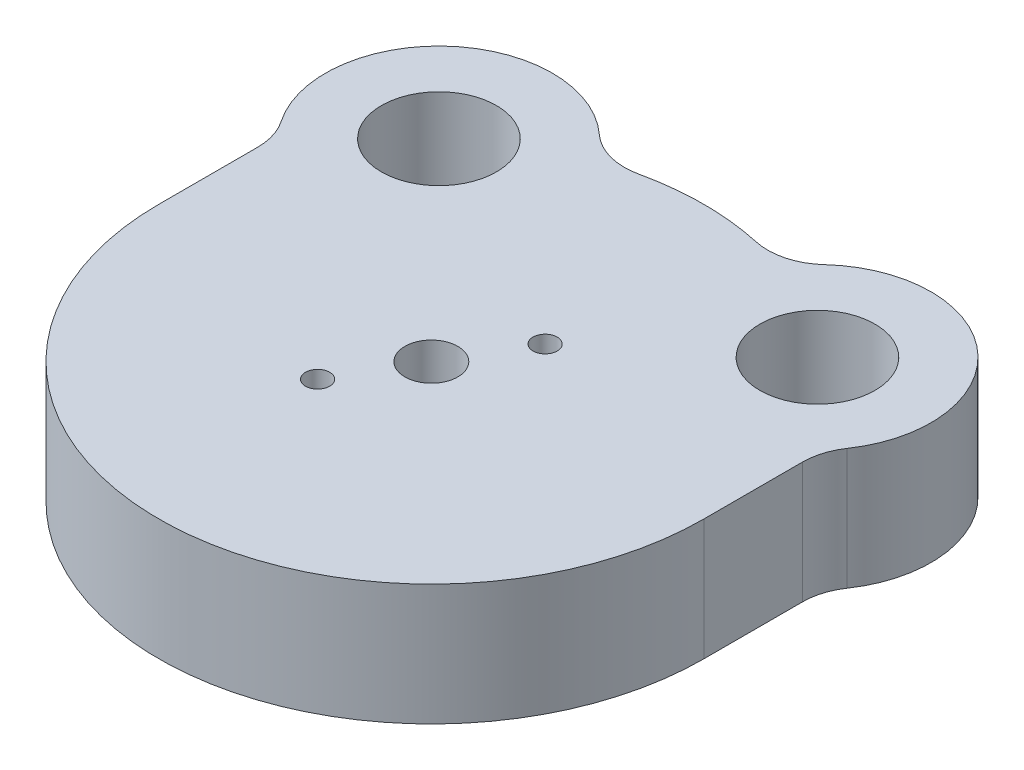
from build123d import *

# Parameters (mm, degrees)
BOSS_EXTRUDE1_DEPTH   = 40
FILLET1_R             = 20
CUT_EXTRUDE2_REACH    = 150.682
SKETCH3_R             = 19
M20_TAPPED_HOLE1_D    = 17.5
SKETCH8_R             = 15
CUT_EXTRUDE3_DEPTH    = 10
M6_TAPPED_HOLE1_D     = 5
M6_TAPPED_HOLE1_DEPTH = 17
M6_TAPPED_HOLE1_TIP   = 1.502151548
F_8_0MM_DOWEL_HOLE1_D = 8


with BuildPart() as part:
    # Sketch1 → Boss-Extrude1 (new body)
    with BuildSketch(Plane(origin=(0, 0, 0), x_dir=(1, 0, 0), z_dir=(0, 1, 0))):
        with BuildLine():
            Line((-90, 0), (-90, 39.504902432))
            ThreePointArc((-90, 39.504902432), (-85.182396525, 94.862332258), (-30.561841884, 84.652075111))
            ThreePointArc((-30.561841884, 84.652075111), (0, 90), (30.561841884, 84.652075111))
            ThreePointArc((30.561841884, 84.652075111), (85.182396525, 94.862332258), (90, 39.504902432))
            Line((90, 39.504902432), (90, 0))
            ThreePointArc((90, 0), (0, -90), (-90, 0))
        make_face()
    extrude(amount=BOSS_EXTRUDE1_DEPTH)

    # Fillet1
    fillet1_edges = [part.edges().sort_by_distance(p)[0] for p in [
        (30.561841884, 20, -84.652075111),
        (-30.561841884, 20, -84.652075111),
        (90, 20, -39.504902432),
        (-90, 20, -39.504902432),
    ]]
    fillet(fillet1_edges, radius=FILLET1_R)

    # Sketch3 → Cut-Extrude2 (cut, up to next)
    with BuildSketch(Plane(origin=(0, 0, 0), x_dir=(1, 0, 0), z_dir=(0, 1, 0)), mode=Mode.PRIVATE) as cut_extrude2_sk1:
        with Locations((-62.5, 65)):
            Circle(SKETCH3_R)
    cut_extrude2_tool1 = extrude(cut_extrude2_sk1.sketch, amount=CUT_EXTRUDE2_REACH, mode=Mode.PRIVATE) & part.part
    # Sketch3 → Cut-Extrude2 (cut, up to next)
    with BuildSketch(Plane(origin=(0, 0, 0), x_dir=(1, 0, 0), z_dir=(0, 1, 0)), mode=Mode.PRIVATE) as cut_extrude2_sk2:
        with Locations((62.5, 65)):
            Circle(SKETCH3_R)
    cut_extrude2_tool2 = extrude(cut_extrude2_sk2.sketch, amount=CUT_EXTRUDE2_REACH, mode=Mode.PRIVATE) & part.part
    add(cut_extrude2_tool1.solids().sort_by_distance((-62.5, 0, -65))[0], mode=Mode.SUBTRACT)
    add(cut_extrude2_tool2.solids().sort_by_distance((62.5, 0, -65))[0], mode=Mode.SUBTRACT)

    # M20 Tapped Hole1 (through all)
    with Locations(Plane(origin=(0, 40, 0), x_dir=(1, 0, 0), z_dir=(0, 1, 0))):
        with Locations((0, 0)):
            Hole(M20_TAPPED_HOLE1_D / 2)

    # Sketch8 → Cut-Extrude3 (cut)
    with BuildSketch(Plane.XZ):
        Circle(SKETCH8_R)
    extrude(amount=-CUT_EXTRUDE3_DEPTH, mode=Mode.SUBTRACT)

    # M6 Tapped Hole1
    with Locations(Plane(origin=(0, 0, 0), x_dir=(-1, 0, 0), z_dir=(0, -1, 0))):
        with Locations((-21.650635095, -12.237722392), (21.650635095, -12.5), (0, 25)):
            Hole(M6_TAPPED_HOLE1_D / 2, depth=M6_TAPPED_HOLE1_DEPTH)
            with Locations((0, 0, -(M6_TAPPED_HOLE1_DEPTH + M6_TAPPED_HOLE1_TIP / 2))):  # 118° drill point
                Cone(0, M6_TAPPED_HOLE1_D / 2, M6_TAPPED_HOLE1_TIP, mode=Mode.SUBTRACT)

    # Ø8.0mm Dowel Hole1 (through all)
    with Locations(Plane(origin=(0, 0, 0), x_dir=(-1, 0, 0), z_dir=(0, -1, 0))):
        with Locations((13.75, -23.815698604), (-13.75, 23.815698604)):
            Hole(F_8_0MM_DOWEL_HOLE1_D / 2)


solid = part.part
